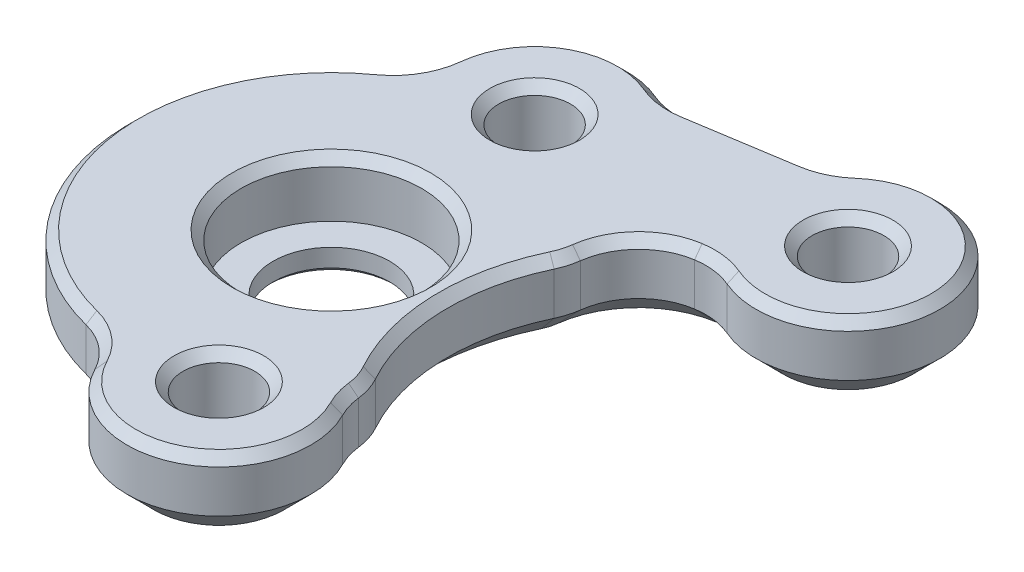
from build123d import *

# Parameters (mm, degrees)
SKETCH1_R           = 9
SKETCH1_R_2         = 4.025
BOSS_EXTRUDE1_DEPTH = 3.5
SKETCH2_R           = 4.1
SKETCH2_R_2         = 1.6
BOSS_EXTRUDE2_DEPTH = 3.5
SKETCH6_R           = 9
CUT_EXTRUDE2_DEPTH  = 17.27435259
CUT_EXTRUDE1_START  = -3.5
SKETCH3_R           = 1.6
CUT_EXTRUDE1_DEPTH  = 3.5
SKETCH4_R           = 1.6
BOSS_EXTRUDE3_DEPTH = 3.5
SKETCH5_R           = 4.025
SKETCH5_R_2         = 2.6
BOSS_EXTRUDE4_DEPTH = 1
FILLET1_R           = 3
FILLET9_R           = 3
CHAMFER_1_SIZE      = 1.2
CHAMFER_2_SIZE      = 0.2
CHAMFER_3_SIZE      = 0.4


with BuildPart() as part:
    # Sketch1 → Boss-Extrude1 (new body)
    with BuildSketch(Plane(origin=(0, 0, 0), x_dir=(1, 0, 0), z_dir=(0, 1, 0))):
        with Locations(Location((0, 0, 0), (0, 0, 270))):
            Circle(SKETCH1_R)
        with Locations(Location((0, 0, 0), (0, 0, 270))):
            Circle(SKETCH1_R_2, mode=Mode.SUBTRACT)
    extrude(amount=BOSS_EXTRUDE1_DEPTH)

    # Sketch2 → Boss-Extrude2 (add)
    # profile 1 of 2: a face of its own
    with BuildSketch(Plane(origin=(0, 3.5, 0), x_dir=(1, 0, 0), z_dir=(0, 1, 0))):
        with Locations((3.343277014, -8.355985807)):
            Circle(SKETCH2_R)
        with Locations((3.343277014, -8.355985807)):
            Circle(SKETCH2_R_2, mode=Mode.SUBTRACT)
    # profile 2 of 2: a face of its own
    with BuildSketch(Plane(origin=(0, 3.5, 0), x_dir=(1, 0, 0), z_dir=(0, 1, 0))):
        with Locations((0.061177946, 8.999792068)):
            Circle(SKETCH2_R)
        with Locations((0.061177946, 8.999792068)):
            Circle(SKETCH2_R_2, mode=Mode.SUBTRACT)
    extrude(amount=-BOSS_EXTRUDE2_DEPTH)

    # Sketch6 → Cut-Extrude2 (cut, through all)
    with BuildSketch(Plane(origin=(0, 0, 0), x_dir=(-1, 0, 0), z_dir=(0, -1, 0))):
        with Locations((-14.2, 0)):
            Circle(SKETCH6_R)
    extrude(amount=-CUT_EXTRUDE2_DEPTH, mode=Mode.SUBTRACT)

    # Sketch3 → Cut-Extrude1 (cut)
    with BuildSketch(Plane(origin=(0, 0, 0), x_dir=(-1, 0, 0), z_dir=(0, -1, 0)).offset(CUT_EXTRUDE1_START)):
        with Locations(Location((-0.061177946, 8.999792068, 0), (0, 0, 270))):
            Circle(SKETCH3_R)
        with Locations(Location((-3.343277014, -8.355985807, 0), (0, 0, 270))):
            Circle(SKETCH3_R)
    extrude(amount=CUT_EXTRUDE1_DEPTH, mode=Mode.SUBTRACT)

    # Sketch4 → Boss-Extrude3 (add)
    with BuildSketch(Plane(origin=(0, 0, 0), x_dir=(-1, 0, 0), z_dir=(0, -1, 0))):
        with BuildLine():
            Line((-2.353733001, 12.398937743), (-8.897987933, 13.432234974))
            ThreePointArc((-8.897987933, 13.432234974), (-16.176141716, 11.544244815), (-9.833757914, 7.505656319))
            Line((-9.833757914, 7.505656319), (-5.813078926, 6.870816065))
            ThreePointArc((-5.813078926, 6.870816065), (-4.964487715, 7.506920922), (-4.04696144, 8.038787415))
            ThreePointArc((-4.04696144, 8.038787415), (-3.883103044, 10.484005175), (-2.353733001, 12.398937743))
        make_face()
        with Locations(Location((-12.126312969, 10.904801994, 0), (0, 0, 90))):
            Circle(SKETCH4_R, mode=Mode.SUBTRACT)
    extrude(amount=-BOSS_EXTRUDE3_DEPTH)

    # Sketch5 → Boss-Extrude4 (add)
    with BuildSketch(Plane(origin=(0, 0, 0), x_dir=(-1, 0, 0), z_dir=(0, -1, 0))):
        with Locations(Location((0, 0, 0), (0, 0, 90))):
            Circle(SKETCH5_R)
        with Locations(Location((0, 0, 0), (0, 0, 90))):
            Circle(SKETCH5_R_2, mode=Mode.SUBTRACT)
    extrude(amount=-BOSS_EXTRUDE4_DEPTH)

    # Fillet1
    # the kernel refuses this fillet: 3 mm, written as the material it adds along each edge
    with BuildSketch(Plane(origin=(-0.71019136, 3.5, 8.97193559), x_dir=(-0.9865858542334134, 0, -0.1632432302624714), z_dir=(0, -1, 0))) as fillet1_piece_1:
        with BuildLine():
            CenterArc((1.782533661, -2.98917289), FILLET1_R, 94.869271374, 48.27534012)
            ThreePointArc((-0.617922081, -1.189780705), (-0.260000299, -0.620318503), (0, 0))
            ThreePointArc((0, 0), (0.763942997, -0.03248133), (1.527885995, 0))
        make_face()
    extrude(amount=3.5)
    with BuildSketch(Plane(origin=(-3.93730186, 3.5, -8.093062095), x_dir=(-0.8588495215516518, 0, 0.5122279759350309), z_dir=(0, -1, 0))) as fillet1_piece_2:
        with BuildLine():
            CenterArc((1.782533661, 2.98917289), FILLET1_R, 216.855388506, 48.27534012)
            ThreePointArc((-0.617922081, 1.189780705), (-0.260000299, 0.620318503), (0, 0))
            ThreePointArc((0, 0), (0.763942997, 0.03248133), (1.527885995, 0))
        make_face()
    extrude(amount=3.5)
    with BuildSketch(Plane(origin=(8.897987933, 0, -13.432234974), x_dir=(-0.9877631090139599, 0, 0.15596166346598195), z_dir=(0, 1, 0))) as fillet1_piece_3:
        with BuildLine():
            CenterArc((1.001412857, -3), FILLET1_R, 90, 32.320518146)
            ThreePointArc((-0.602552177, -0.464788732), (-0.290469322, -0.24640426), (0, 0))
            Line((0, 0), (1.001412857, 0))
        make_face()
    extrude(amount=3.5)
    with BuildSketch(Plane(origin=(2.353733001, 0, -12.398937743), x_dir=(-0.8773738132879287, 0, -0.4798074527939294), z_dir=(0, 1, 0)), Plane(origin=(9.833757914, 0, -7.505656319), x_dir=(0.8773738132879222, 0, 0.47980745279394127), z_dir=(0, 1, 0))) as fillet1_piece_4:
        with BuildLine():
            CenterArc((1.039393717, -2.987053466), FILLET1_R, 95.324882893, 32.320518146)
            Line((-0.792924625, -0.611635715), (0, 0))
            ThreePointArc((0, 0), (0.380492343, -0.017693596), (0.760984685, 0))
        make_face()
    extrude(amount=3.5)
    # the kernel refuses this fillet: 3 mm, written as the material it takes off along each edge
    with BuildSketch(Plane(origin=(7.1, 6.983871428, 5.530822724), x_dir=(-0.6413091964506672, 0, 0.7672825519636162), z_dir=(0, -1, 0))) as fillet1_2_piece_1:
        with BuildLine():
            CenterArc((2.400494629, 2.413903277), FILLET1_R, 201.072777054, 32.502187501)
            ThreePointArc((-0.398878795, 1.335242797), (-0.173557144, 0.675353237), (0, 0))
            ThreePointArc((0, 0), (0.309591521, -0.005326404), (0.619183042, 0))
        make_face()
    extrude(amount=10.467742856, mode=Mode.SUBTRACT)
    with BuildSketch(Plane(origin=(7.1, 8.410224582, -5.530822724), x_dir=(-0.5247859915025788, 0, 0.8512341999254115), z_dir=(0, -1, 0))) as fillet1_2_piece_2:
        with BuildLine():
            CenterArc((2.291438138, 2.982087035), FILLET1_R, 203.232841743, 60.502793026)
            ThreePointArc((-0.465290008, 1.798680965), (-0.279182448, 0.88730199), (0, 0))
            ThreePointArc((0, 0), (0.982044916, 0.053738894), (1.964089833, 0))
        make_face()
    extrude(amount=13.320449164, mode=Mode.SUBTRACT)

    # Fillet9
    fillet9_edges = [part.edges().sort_by_distance(p)[0] for p in [
        (6.702912221, 1.75, 6.005911068),
        (5.813078926, 1.75, -6.870816065),
    ]]
    fillet(fillet9_edges, radius=FILLET9_R)

    # 倒角1
    chamfer_1_edges = [part.edges().sort_by_distance(p)[0] for p in [
        (16.176141716, 0, -11.544244815),
        (5.625860467, 0, -12.915586358),
        (-2.007663811, 0, -12.539551069),
        (5.204560758, 0, 0.286483569),
        (5.220072831, 0, 12.001206989),
        (-8.84326494, 0, 1.672323294),
        (6.564091926, 0, 4.905386326),
        (9.687844205, 0, -7.362609827),
        (8.715099113, 0, -13.523365587),
        (2.49964671, 0, -12.541984235),
        (-4.406035705, 0, -8.239061366),
        (-1.093245074, 0, 9.27901385),
        (8.843752485, 0, -7.349340608),
        (6.238006504, 0, -4.301725459),
        (7.158194759, 0, -6.475494242),
        (6.796639749, 0, 5.998875214),
    ]]
    chamfer(chamfer_1_edges, length=CHAMFER_1_SIZE)

    # 倒角2
    chamfer_2_edges = [part.edges().sort_by_distance(p)[0] for p in [
        (4.706817353, 0, 9.19309855),
        (1.13707684, 0, -7.815544808),
        (12.126312969, 0, -9.304801994),
        (0, 0, 2.6),
    ]]
    chamfer(chamfer_2_edges, length=CHAMFER_2_SIZE)

    # 倒角3
    chamfer_3_edges = [part.edges().sort_by_distance(p)[0] for p in [
        (16.176141716, 3.5, -11.544244815),
        (5.625860467, 3.5, -12.915586358),
        (-2.007663811, 3.5, -12.539551069),
        (5.204560758, 3.5, 0.286483569),
        (-8.84326494, 3.5, 1.672323294),
        (5.220072831, 3.5, 12.001206989),
        (6.238006504, 3.5, -4.301725459),
        (9.687844205, 3.5, -7.362609827),
        (8.715099113, 3.5, -13.523365587),
        (2.49964671, 3.5, -12.541984235),
        (-4.406035705, 3.5, -8.239061366),
        (-1.093245074, 3.5, 9.27901385),
        (8.843752485, 3.5, -7.349340608),
        (6.564091926, 3.5, 4.905386326),
        (7.158194759, 3.5, -6.475494242),
        (6.796639749, 3.5, 5.998875214),
        (4.706817353, 3.5, 9.19309855),
        (1.13707684, 3.5, -7.815544808),
        (0, 3.5, -4.025),
        (12.126312969, 3.5, -9.304801994),
    ]]
    chamfer(chamfer_3_edges, length=CHAMFER_3_SIZE)


solid = part.part
